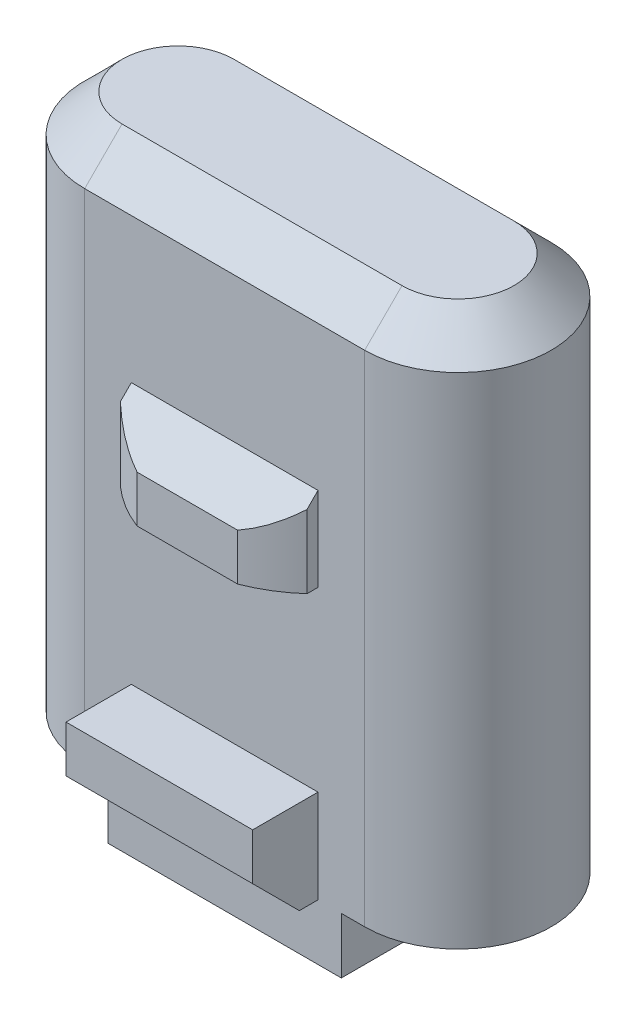
from build123d import *

# Parameters (mm, degrees)
EXTRUDE_1_DEPTH      = 12.7
CUT_EXTRUDE_1_REACH  = 17.534
SKETCH_3_W           = 2.5
SKETCH_3_H           = 1.2
EXTRUDE_2_DEPTH      = 2
EXTRUDE_2_DEPTH_BACK = 2
SKETCH_5_W           = 1.4
SKETCH_5_H           = 2
CUT_EXTRUDE_2_REACH  = 17.39
CHAMFER_1_SIZE       = 1
CHAMFER_2_SIZE       = 0.8


with BuildPart() as part:
    # 草图2 → 凸台-拉伸1 (new body)
    with BuildSketch(Plane(origin=(0, 0, 0), x_dir=(1, 0, 0), z_dir=(0, 1, 0))):
        with BuildLine():
            Line((0, 2), (6, 2))
            ThreePointArc((6, 2), (8, 0), (6, -2))
            Line((6, -2), (0, -2))
            ThreePointArc((0, -2), (-2, 0), (0, 2))
        make_face()
    extrude(amount=EXTRUDE_1_DEPTH)

    # 草图3 → 切除-拉伸1 (cut, up to next)
    with BuildSketch(Plane.XY.offset(2), mode=Mode.PRIVATE) as cut_extrude_1_sk1:
        with Locations((-0.75, 0.6)):
            Rectangle(SKETCH_3_W, SKETCH_3_H)
    cut_extrude_1_tool1 = extrude(cut_extrude_1_sk1.sketch, amount=-CUT_EXTRUDE_1_REACH, mode=Mode.PRIVATE) & part.part
    # 草图3 → 切除-拉伸1 (cut, up to next)
    with BuildSketch(Plane.XY.offset(2), mode=Mode.PRIVATE) as cut_extrude_1_sk2:
        with Locations((6.75, 0.6)):
            Rectangle(SKETCH_3_W, SKETCH_3_H)
    cut_extrude_1_tool2 = extrude(cut_extrude_1_sk2.sketch, amount=-CUT_EXTRUDE_1_REACH, mode=Mode.PRIVATE) & part.part
    add(cut_extrude_1_tool1.solids().sort_by_distance((-0.75, 0.6, 2))[0], mode=Mode.SUBTRACT)
    add(cut_extrude_1_tool2.solids().sort_by_distance((6.75, 0.6, 2))[0], mode=Mode.SUBTRACT)

    # 草图5 → 凸台-拉伸2 (add, two sides: drawn at the far end of the back side and taken through both)
    with BuildSketch(Plane.ZY.offset(-3).offset(-EXTRUDE_2_DEPTH_BACK)):
        Polygon((-2, 7), (-2.8, 7), (-2.8, 8), (-2, 8.8), align=None)
        Polygon((2, 8.8), (2, 7), (2.8, 7), (2.8, 8), align=None)
        with Locations((-2.7, 2.2)):
            Rectangle(SKETCH_5_W, SKETCH_5_H)
        with Locations((2.7, 2.2)):
            Rectangle(SKETCH_5_W, SKETCH_5_H)
    extrude(amount=EXTRUDE_2_DEPTH + EXTRUDE_2_DEPTH_BACK)

    # 草图6 → 切除-拉伸2 (cut, up to next)
    with BuildSketch(Plane(origin=(0, 12.7, 0), x_dir=(1, 0, 0), z_dir=(0, 1, 0)), mode=Mode.PRIVATE) as cut_extrude_2_sk1:
        with BuildLine():
            Line((1.922967039, 2.8), (1, 2.8))
            Line((1, 2.8), (1, 2.236067977))
            ThreePointArc((1, 2.236067977), (1.435858768, 2.559973087), (1.922967039, 2.8))
        make_face()
    cut_extrude_2_tool1 = extrude(cut_extrude_2_sk1.sketch, amount=-CUT_EXTRUDE_2_REACH, mode=Mode.PRIVATE) & part.part
    # 草图6 → 切除-拉伸2 (cut, up to next)
    with BuildSketch(Plane(origin=(0, 12.7, 0), x_dir=(1, 0, 0), z_dir=(0, 1, 0)), mode=Mode.PRIVATE) as cut_extrude_2_sk2:
        with BuildLine():
            Line((4.077032961, -2.8), (5, -2.8))
            Line((5, -2.8), (5, -2.236067977))
            ThreePointArc((5, -2.236067977), (4.564141232, -2.559973087), (4.077032961, -2.8))
        make_face()
    cut_extrude_2_tool2 = extrude(cut_extrude_2_sk2.sketch, amount=-CUT_EXTRUDE_2_REACH, mode=Mode.PRIVATE) & part.part
    # 草图6 → 切除-拉伸2 (cut, up to next)
    with BuildSketch(Plane(origin=(0, 12.7, 0), x_dir=(1, 0, 0), z_dir=(0, 1, 0)), mode=Mode.PRIVATE) as cut_extrude_2_sk3:
        with BuildLine():
            Line((5, 2.8), (4.077032961, 2.8))
            ThreePointArc((4.077032961, 2.8), (4.564141232, 2.559973087), (5, 2.236067977))
            Line((5, 2.236067977), (5, 2.8))
        make_face()
    cut_extrude_2_tool3 = extrude(cut_extrude_2_sk3.sketch, amount=-CUT_EXTRUDE_2_REACH, mode=Mode.PRIVATE) & part.part
    # 草图6 → 切除-拉伸2 (cut, up to next)
    with BuildSketch(Plane(origin=(0, 12.7, 0), x_dir=(1, 0, 0), z_dir=(0, 1, 0)), mode=Mode.PRIVATE) as cut_extrude_2_sk4:
        with BuildLine():
            Line((1, -2.236067977), (1, -2.8))
            Line((1, -2.8), (1.922967039, -2.8))
            ThreePointArc((1.922967039, -2.8), (1.435858768, -2.559973087), (1, -2.236067977))
        make_face()
    cut_extrude_2_tool4 = extrude(cut_extrude_2_sk4.sketch, amount=-CUT_EXTRUDE_2_REACH, mode=Mode.PRIVATE) & part.part
    add(cut_extrude_2_tool1.solids().sort_by_distance((1.284979, 12.7, -2.624216))[0], mode=Mode.SUBTRACT)
    add(cut_extrude_2_tool2.solids().sort_by_distance((4.715021, 12.7, 2.624216))[0], mode=Mode.SUBTRACT)
    add(cut_extrude_2_tool3.solids().sort_by_distance((4.715021, 12.7, -2.624216))[0], mode=Mode.SUBTRACT)
    add(cut_extrude_2_tool4.solids().sort_by_distance((1.284979, 12.7, 2.624216))[0], mode=Mode.SUBTRACT)

    # 倒角1
    chamfer_1_edges = [part.edges().sort_by_distance(p)[0] for p in [
        (3, 1.2, 3.4),
        (3, 1.2, -3.4),
    ]]
    chamfer(chamfer_1_edges, length=CHAMFER_1_SIZE)

    # 倒角2
    chamfer_2_edges = [part.edges().sort_by_distance(p)[0] for p in [
        (8, 12.7, 0),
        (3, 12.7, -2),
        (3, 12.7, 2),
        (-2, 12.7, 0),
    ]]
    chamfer(chamfer_2_edges, length=CHAMFER_2_SIZE)


solid = part.part
